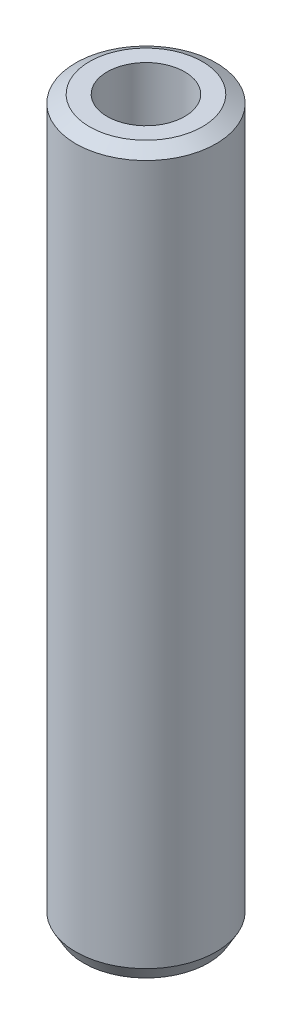
from build123d import *
from OCP.BRepFilletAPI import BRepFilletAPI_MakeChamfer

# Parameters (mm, degrees)
SKETCH1_R           = 7.5
BOSS_EXTRUDE1_DEPTH = 77.119118684
SKETCH2_R           = 4.142606072
CUT_EXTRUDE1_DEPTH  = 78.845092758
CHAMFER1_SIZE       = 0.844707402
CHAMFER1_SIZE2      = 1.463076137


with BuildPart() as part:
    # Sketch1 → Boss-Extrude1 (new body)
    with BuildSketch(Plane(origin=(0, 0, 0), x_dir=(1, 0, 0), z_dir=(0, 1, 0))):
        Circle(SKETCH1_R)
    extrude(amount=BOSS_EXTRUDE1_DEPTH)

    # Sketch2 → Cut-Extrude1 (cut, through all)
    with BuildSketch(Plane(origin=(0, 0, 0), x_dir=(1, 0, 0), z_dir=(0, 1, 0))):
        Circle(SKETCH2_R)
    extrude(amount=CUT_EXTRUDE1_DEPTH, mode=Mode.SUBTRACT)

    # Chamfer1: one chamfer whose edges measure the first distance from different faces: ONE call of the kernel's chamfer builder (chamfer() names one face for all edges)
    chamfer1_edges_1 = [part.edges().sort_by_distance(p)[0] for p in [
        (-7.5, 77.119118684, 0),
    ]]
    chamfer1_side_1 = [part.faces().sort_by_distance(p)[0] for p in [
        (-7.5, 38.559559342, 0),
    ]]
    chamfer1_edges_2 = [part.edges().sort_by_distance(p)[0] for p in [
        (-7.5, 0, 0),
    ]]
    chamfer1_side_2 = [part.faces().sort_by_distance(p)[0] for p in [
        (-7.287867966, 0, 0),
    ]]
    chamfer1 = BRepFilletAPI_MakeChamfer(part.part.solid().wrapped)
    for e in chamfer1_edges_1:
        chamfer1.Add(CHAMFER1_SIZE, CHAMFER1_SIZE2, e.wrapped, chamfer1_side_1[0].wrapped)  # the first distance lies on this face
    for e in chamfer1_edges_2:
        chamfer1.Add(CHAMFER1_SIZE, CHAMFER1_SIZE2, e.wrapped, chamfer1_side_2[0].wrapped)  # the first distance lies on this face
    add(Compound.cast(chamfer1.Shape()), mode=Mode.REPLACE)


solid = part.part
